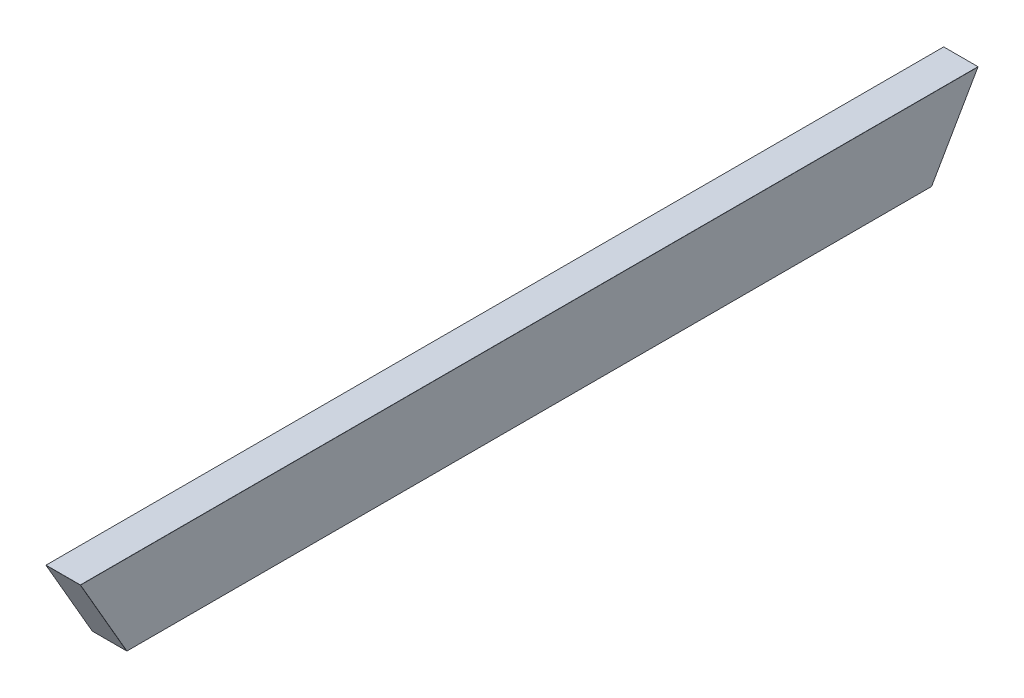
from build123d import *
from OCP.BRepFilletAPI import BRepFilletAPI_MakeChamfer

# Parameters (mm, degrees)
SKETCH1_W           = 3
SKETCH1_H           = 7
BOSS_EXTRUDE1_DEPTH = 39
DRAFT1_ANGLE        = -30
DRAFT2_ANGLE        = -30
CHAMFER1_SIZE       = 0.01
CHAMFER2_SIZE       = 0.007320508
CHAMFER2_SIZE_2     = 0.01
CHAMFER2_SIZE_3     = 0.027320508
CHAMFER2_SIZE_4     = 0.007758146
CHAMFER2_SIZE_5     = 0.017186236


with BuildPart() as part:
    # Sketch1 → Boss-Extrude1 (new, symmetric)
    with BuildSketch(Plane.XY):
        Rectangle(SKETCH1_W, SKETCH1_H)
    extrude(amount=BOSS_EXTRUDE1_DEPTH, both=True)

    # Draft1
    draft1_faces = [part.faces().sort_by_distance(p)[0] for p in [
        (0, 0, 39),
    ]]
    draft(draft1_faces, Plane(origin=(1.5, 3.5, 39), x_dir=(1, 0, 0), z_dir=(0, 1, 0)), DRAFT1_ANGLE)

    # Draft2
    draft2_faces = [part.faces().sort_by_distance(p)[0] for p in [
        (0, 0, -39),
    ]]
    draft(draft2_faces, Plane(origin=(1.5, 3.5, 39), x_dir=(1, 0, 0), z_dir=(0, 1, 0)), DRAFT2_ANGLE)

    # Chamfer1
    chamfer1_edges = [part.edges().sort_by_distance(p)[0] for p in [
        (-1.5, 3.5, 0),
        (1.5, 3.5, 0),
        (1.5, -3.5, 0),
        (-1.5, -3.5, 0),
    ]]
    chamfer(chamfer1_edges, length=CHAMFER1_SIZE)

    # Chamfer2
    chamfer2_edges_1 = [part.edges().sort_by_distance(p)[0] for p in [
        (0, 3.5, -39),
    ]]
    chamfer2_side_1 = [part.faces().sort_by_distance(p)[0] for p in [
        (0, 3.5, -38.99985359),
    ]]
    chamfer2_edges_2 = [part.edges().sort_by_distance(p)[0] for p in [
        (0, -3.5, -34.958548116),
    ]]
    chamfer2_side_2 = [part.faces().sort_by_distance(p)[0] for p in [
        (0, -3.499826795, -34.958648116),
    ]]
    chamfer2_edges_3 = [part.edges().sort_by_distance(p)[0] for p in [
        (1.495, 3.495, -38.997113249),
    ]]
    chamfer2_side_3 = [part.faces().sort_by_distance(p)[0] for p in [
        (1.494882708, 3.494912031, -38.99706246),
    ]]
    chamfer2_edges_4 = [part.edges().sort_by_distance(p)[0] for p in [
        (1.495, 3.495, 38.997113249),
    ]]
    chamfer2_side_4 = [part.faces().sort_by_distance(p)[0] for p in [
        (1.494958531, 3.495041469, 38.996969596),
    ]]
    chamfer2_edges_5 = [part.edges().sort_by_distance(p)[0] for p in [
        (-1.495, 3.495, -38.997113249),
    ]]
    chamfer2_side_5 = [part.faces().sort_by_distance(p)[0] for p in [
        (-1.494882708, 3.494912031, -38.99706246),
    ]]
    chamfer2_edges_6 = [part.edges().sort_by_distance(p)[0] for p in [
        (-1.495, 3.495, 38.997113249),
    ]]
    chamfer2_side_6 = [part.faces().sort_by_distance(p)[0] for p in [
        (-1.494958531, 3.495041469, 38.996969596),
    ]]
    chamfer2_edges_7 = [part.edges().sort_by_distance(p)[0] for p in [
        (0, 3.5, 39),
    ]]
    chamfer2_side_7 = [part.faces().sort_by_distance(p)[0] for p in [
        (0, 3.5, 38.99985359),
    ]]
    chamfer2_edges_8 = [part.edges().sort_by_distance(p)[0] for p in [
        (0, -3.5, 34.958548116),
    ]]
    chamfer2_side_8 = [part.faces().sort_by_distance(p)[0] for p in [
        (0, -3.499826795, 34.958648116),
    ]]
    chamfer2 = BRepFilletAPI_MakeChamfer(part.part.solid().wrapped)
    for e in chamfer2_edges_1:
        chamfer2.Add(CHAMFER2_SIZE, CHAMFER2_SIZE_2, e.wrapped, chamfer2_side_1[0].wrapped)
    for e in chamfer2_edges_2:
        chamfer2.Add(CHAMFER2_SIZE_2, CHAMFER2_SIZE_3, e.wrapped, chamfer2_side_2[0].wrapped)
    for e in chamfer2_edges_3:
        chamfer2.Add(CHAMFER2_SIZE_4, CHAMFER2_SIZE_2, e.wrapped, chamfer2_side_3[0].wrapped)
    for e in chamfer2_edges_4:
        chamfer2.Add(CHAMFER2_SIZE_2, CHAMFER2_SIZE_4, e.wrapped, chamfer2_side_4[0].wrapped)
    for e in chamfer2_edges_5:
        chamfer2.Add(CHAMFER2_SIZE_4, CHAMFER2_SIZE_2, e.wrapped, chamfer2_side_5[0].wrapped)
    for e in chamfer2_edges_6:
        chamfer2.Add(CHAMFER2_SIZE_2, CHAMFER2_SIZE_4, e.wrapped, chamfer2_side_6[0].wrapped)
    for e in chamfer2_edges_7:
        chamfer2.Add(CHAMFER2_SIZE_2, CHAMFER2_SIZE, e.wrapped, chamfer2_side_7[0].wrapped)
    for e in chamfer2_edges_8:
        chamfer2.Add(CHAMFER2_SIZE_3, CHAMFER2_SIZE_2, e.wrapped, chamfer2_side_8[0].wrapped)
    add(Compound.cast(chamfer2.Shape()), mode=Mode.REPLACE)
    chamfer2_2_edges_1 = [part.edges().sort_by_distance(p)[0] for p in [
        (1.499330127, -3.490669873, -34.963934867),
    ]]
    chamfer2_2_side_1 = [part.faces().sort_by_distance(p)[0] for p in [
        (1.499178941, -3.490556484, -34.964000332),
    ]]
    chamfer2_2_edges_2 = [part.edges().sort_by_distance(p)[0] for p in [
        (-1.499330127, -3.490669873, -34.963934867),
    ]]
    chamfer2_2_side_2 = [part.faces().sort_by_distance(p)[0] for p in [
        (-1.499178941, -3.490556484, -34.964000332),
    ]]
    chamfer2_2 = BRepFilletAPI_MakeChamfer(part.part.solid().wrapped)
    for e in chamfer2_2_edges_1:
        chamfer2_2.Add(CHAMFER2_SIZE_5, CHAMFER2_SIZE_2, e.wrapped, chamfer2_2_side_1[0].wrapped)
    for e in chamfer2_2_edges_2:
        chamfer2_2.Add(CHAMFER2_SIZE_5, CHAMFER2_SIZE_2, e.wrapped, chamfer2_2_side_2[0].wrapped)
    add(Compound.cast(chamfer2_2.Shape()), mode=Mode.REPLACE)
    chamfer2_3_edges = [part.edges().sort_by_distance(p)[0] for p in [
        (-1.5, 0.006236096, -36.982874469),
        (-1.5, 0.001698596, 36.980254743),
        (1.5, 0.006236096, -36.982874469),
        (1.5, 0.001698596, 36.980254743),
    ]]
    chamfer(chamfer2_3_edges, length=CHAMFER2_SIZE_2)


solid = part.part
